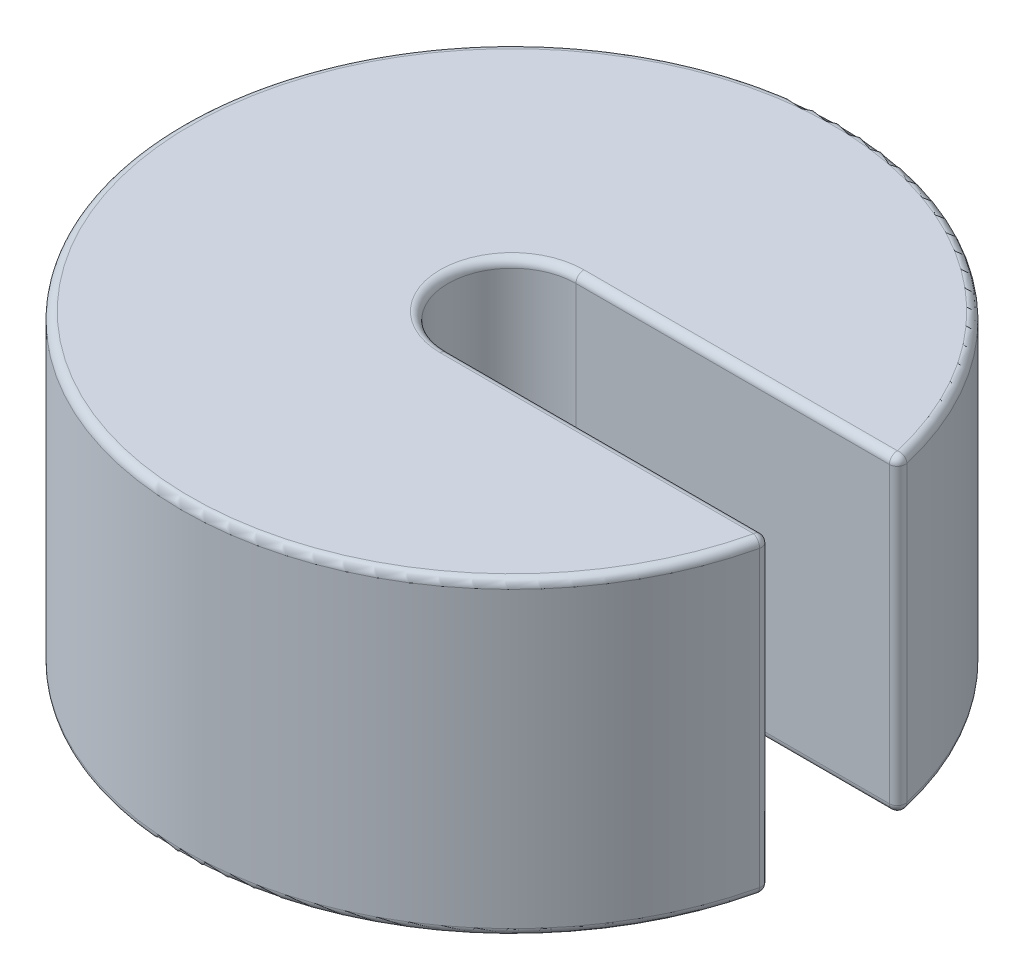
from build123d import *

# Parameters (mm, degrees)
BOSS_EXTRUDE1_DEPTH = 39
FILLET1_R           = 1


with BuildPart() as part:
    # Sketch1 → Boss-Extrude1 (new body)
    with BuildSketch(Plane(origin=(0, 0, 0), x_dir=(1, 0, 0), z_dir=(0, 1, 0))):
        with BuildLine():
            Line((0, 8.05), (40.7117612, 8.05))
            ThreePointArc((40.7117612, 8.05), (-41.5, 0), (40.7117612, -8.05))
            Line((40.7117612, -8.05), (0, -8.05))
            ThreePointArc((0, -8.05), (-8.05, 0), (0, 8.05))
        make_face()
    extrude(amount=BOSS_EXTRUDE1_DEPTH)

    # Fillet1
    fillet1_edges = [part.edges().sort_by_distance(p)[0] for p in [
        (-41.5, 0, 0),
        (-8.05, 0, 0),
        (-41.5, 39, 0),
        (-8.05, 39, 0),
        (40.7117612, 19.5, 8.05),
        (20.3558806, 39, 8.05),
        (20.3558806, 0, 8.05),
        (20.3558806, 39, -8.05),
        (40.7117612, 19.5, -8.05),
        (20.3558806, 0, -8.05),
    ]]
    fillet(fillet1_edges, radius=FILLET1_R)


solid = part.part
